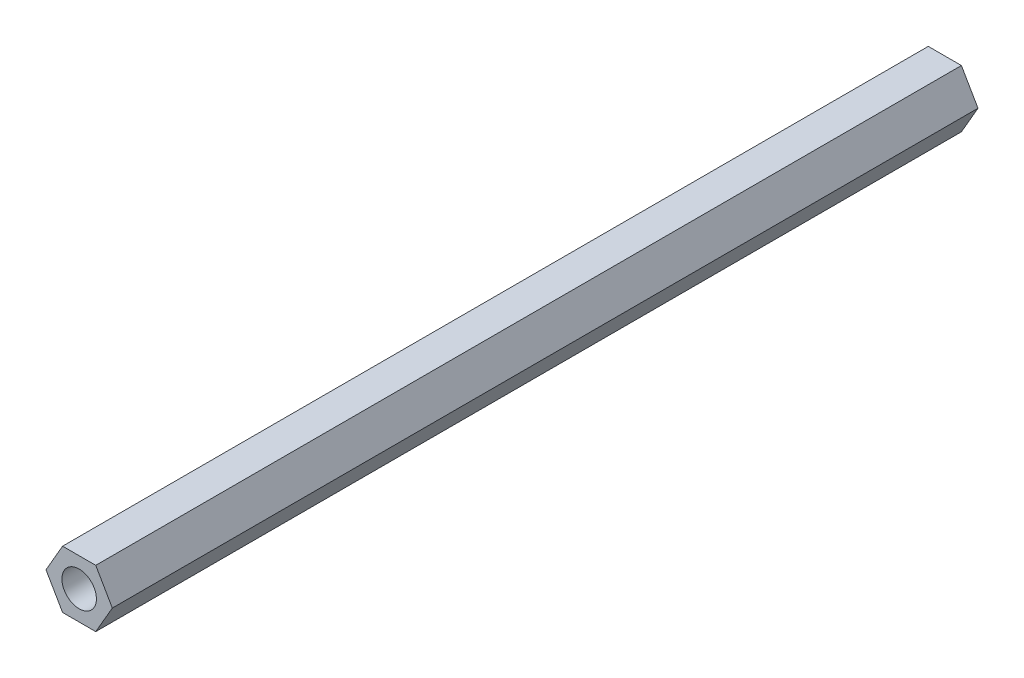
from build123d import *

# Parameters (mm, degrees)
CROQUIS1_R              = 1.5
SALIENTE_EXTRUIR1_DEPTH = 75.36


with BuildPart() as part:
    # Croquis1 → Saliente-Extruir1 (new body)
    with BuildSketch(Plane.XY):
        Polygon((2.886751346, 0), (1.443375673, 2.5), (-1.443375673, 2.5), (-2.886751346, 0), (-1.443375673, -2.5), (1.443375673, -2.5), align=None)
        Circle(CROQUIS1_R, mode=Mode.SUBTRACT)
    extrude(amount=-SALIENTE_EXTRUIR1_DEPTH)


solid = part.part
